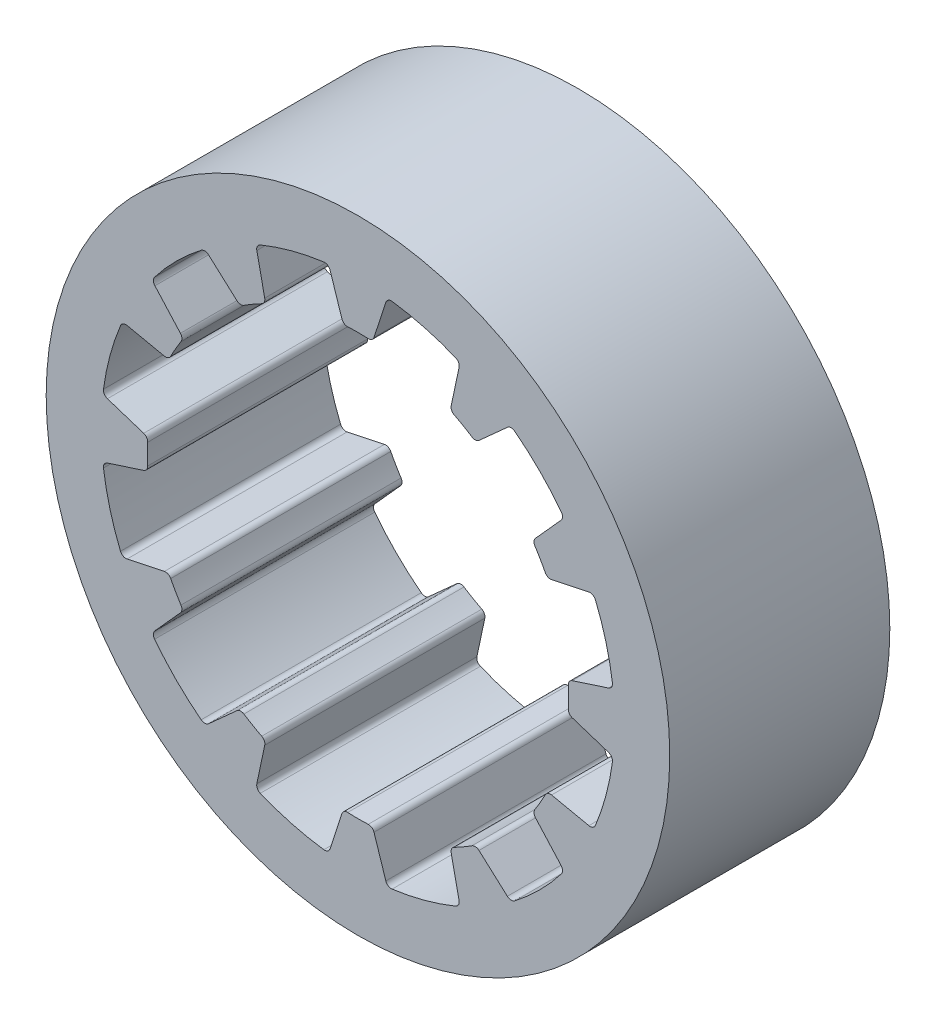
from build123d import *

# Parameters (mm, degrees)
MODEL_R             = 26.9875
BOSS_EXTRUDE1_DEPTH = 19.05


with BuildPart() as part:
    # Model → Boss-Extrude1 (new body)
    with BuildSketch(Plane.XY):
        Circle(MODEL_R)
        with BuildLine():
            ThreePointArc((-8.331075887, 16.209373818), (-8.108047548, 16.43944461), (-8.070485832, 16.757663602))
            Line((-8.070485832, 16.757663602), (-8.754511726, 19.987689799))
            ThreePointArc((-8.754511726, 19.987689799), (-8.707484905, 20.324784918), (-8.455586843, 20.553677922))
            ThreePointArc((-8.455586843, 20.553677922), (-5.752253282, 21.467701488), (-2.95408596, 22.027800642))
            ThreePointArc((-2.95408596, 22.027800642), (-2.621489336, 21.955522516), (-2.412215355, 21.687102989))
            Line((-2.412215355, 21.687102989), (-1.38958606, 18.5478053))
            ThreePointArc((-1.38958606, 18.5478053), (-1.197947162, 18.291000428), (-0.889763559, 18.203267447))
            ThreePointArc((-0.889763559, 18.203267447), (-4e-09, 18.224999999), (0.88976355, 18.203267448))
            ThreePointArc((0.88976355, 18.203267448), (1.197947153, 18.291000429), (1.38958605, 18.547805301))
            Line((1.38958605, 18.547805301), (2.412215346, 21.68710299))
            ThreePointArc((2.412215346, 21.68710299), (2.621489327, 21.955522516), (2.954085951, 22.027800641))
            ThreePointArc((2.954085951, 22.027800641), (5.752253273, 21.467701488), (8.455586835, 20.553677923))
            ThreePointArc((8.455586835, 20.553677923), (8.707484897, 20.324784919), (8.754511717, 19.9876898))
            Line((8.754511717, 19.9876898), (8.070485823, 16.757663603))
            ThreePointArc((8.070485823, 16.757663603), (8.108047539, 16.439444611), (8.331075878, 16.209373819))
            ThreePointArc((8.331075878, 16.209373819), (9.112499995, 15.783312983), (9.872191562, 15.319610264))
            ThreePointArc((9.872191562, 15.319610264), (10.182952881, 15.241497453), (10.47731947, 15.368077548))
            Line((10.47731947, 15.368077548), (12.932591265, 17.575474446))
            ThreePointArc((12.932591265, 17.575474446), (13.248037611, 17.703295585), (13.572213798, 17.599591967))
            ThreePointArc((13.572213798, 17.599591967), (15.715448207, 15.71544821), (17.599591964, 13.572213802))
            ThreePointArc((17.599591964, 13.572213802), (17.703295582, 13.248037614), (17.575474443, 12.932591268))
            Line((17.575474443, 12.932591268), (15.368077544, 10.477319473))
            ThreePointArc((15.368077544, 10.477319473), (15.24149745, 10.182952884), (15.319610261, 9.872191565))
            ThreePointArc((15.319610261, 9.872191565), (15.78331298, 9.112499998), (16.209373816, 8.331075881))
            ThreePointArc((16.209373816, 8.331075881), (16.439444608, 8.108047543), (16.7576636, 8.070485826))
            Line((16.7576636, 8.070485826), (19.987689797, 8.75451172))
            ThreePointArc((19.987689797, 8.75451172), (20.324784916, 8.707484899), (20.55367792, 8.455586837))
            ThreePointArc((20.55367792, 8.455586837), (21.467701485, 5.752253275), (22.027800638, 2.954085954))
            ThreePointArc((22.027800638, 2.954085954), (21.955522513, 2.62148933), (21.687102986, 2.412215349))
            Line((21.687102986, 2.412215349), (18.547805297, 1.389586053))
            ThreePointArc((18.547805297, 1.389586053), (18.291000425, 1.197947156), (18.203267445, 0.889763553))
            ThreePointArc((18.203267445, 0.889763553), (18.224999996, -2e-09), (18.203267445, -0.889763556))
            ThreePointArc((18.203267445, -0.889763556), (18.291000425, -1.19794716), (18.547805298, -1.389586057))
            Line((18.547805298, -1.389586057), (21.687102987, -2.412215353))
            ThreePointArc((21.687102987, -2.412215353), (21.955522514, -2.621489333), (22.027800639, -2.954085957))
            ThreePointArc((22.027800639, -2.954085957), (21.467701485, -5.752253279), (20.55367792, -8.455586841))
            ThreePointArc((20.55367792, -8.455586841), (20.324784915, -8.707484903), (19.987689796, -8.754511723))
            Line((19.987689796, -8.754511723), (16.757663599, -8.070485829))
            ThreePointArc((16.757663599, -8.070485829), (16.439444608, -8.108047546), (16.209373816, -8.331075885))
            ThreePointArc((16.209373816, -8.331075885), (15.78331298, -9.112500002), (15.319610261, -9.872191568))
            ThreePointArc((15.319610261, -9.872191568), (15.24149745, -10.182952888), (15.368077545, -10.477319476))
            Line((15.368077545, -10.477319476), (17.575474443, -12.932591272))
            ThreePointArc((17.575474443, -12.932591272), (17.703295583, -13.248037618), (17.599591965, -13.572213805))
            ThreePointArc((17.599591965, -13.572213805), (15.715448207, -15.715448213), (13.572213799, -17.59959197))
            ThreePointArc((13.572213799, -17.59959197), (13.248037611, -17.703295588), (12.932591265, -17.575474449))
            Line((12.932591265, -17.575474449), (10.47731947, -15.368077551))
            ThreePointArc((10.47731947, -15.368077551), (10.182952881, -15.241497457), (9.872191562, -15.319610268))
            ThreePointArc((9.872191562, -15.319610268), (9.112499996, -15.783312986), (8.331075878, -16.209373822))
            ThreePointArc((8.331075878, -16.209373822), (8.108047539, -16.439444614), (8.070485823, -16.757663607))
            Line((8.070485823, -16.757663607), (8.754511717, -19.987689803))
            ThreePointArc((8.754511717, -19.987689803), (8.707484897, -20.324784922), (8.455586834, -20.553677926))
            ThreePointArc((8.455586834, -20.553677926), (5.752253273, -21.467701491), (2.954085951, -22.027800644))
            ThreePointArc((2.954085951, -22.027800644), (2.621489325, -21.955522517), (2.412215346, -21.687102985))
            Line((2.412215346, -21.687102985), (1.38958605, -18.547805297))
            ThreePointArc((1.38958605, -18.547805297), (1.197947153, -18.291000425), (0.889763549, -18.203267444))
            ThreePointArc((0.889763549, -18.203267444), (-4e-09, -18.224999995), (-0.889763558, -18.203267444))
            ThreePointArc((-0.889763558, -18.203267444), (-1.197947162, -18.291000425), (-1.389586059, -18.547805297))
            Line((-1.389586059, -18.547805297), (-2.412215354, -21.687102986))
            ThreePointArc((-2.412215354, -21.687102986), (-2.621489335, -21.955522513), (-2.954085959, -22.027800639))
            ThreePointArc((-2.954085959, -22.027800639), (-5.75225328, -21.467701485), (-8.455586841, -20.55367792))
            ThreePointArc((-8.455586841, -20.55367792), (-8.707484903, -20.324784915), (-8.754511723, -19.987689797))
            Line((-8.754511723, -19.987689797), (-8.070485829, -16.7576636))
            ThreePointArc((-8.070485829, -16.7576636), (-8.108047546, -16.439444608), (-8.331075884, -16.209373816))
            ThreePointArc((-8.331075884, -16.209373816), (-9.112500001, -15.78331298), (-9.872191567, -15.319610262))
            ThreePointArc((-9.872191567, -15.319610262), (-10.182952886, -15.241497451), (-10.477319475, -15.368077546))
            Line((-10.477319475, -15.368077546), (-12.93259127, -17.575474444))
            ThreePointArc((-12.93259127, -17.575474444), (-13.248037616, -17.703295583), (-13.572213803, -17.599591965))
            ThreePointArc((-13.572213803, -17.599591965), (-15.715448211, -15.715448209), (-17.599591967, -13.572213801))
            ThreePointArc((-17.599591967, -13.572213801), (-17.703295585, -13.248037614), (-17.575474446, -12.932591267))
            Line((-17.575474446, -12.932591267), (-15.368077548, -10.477319472))
            ThreePointArc((-15.368077548, -10.477319472), (-15.241497453, -10.182952883), (-15.319610265, -9.872191564))
            ThreePointArc((-15.319610265, -9.872191564), (-15.783312983, -9.112499999), (-16.209373818, -8.331075882))
            ThreePointArc((-16.209373818, -8.331075882), (-16.439444611, -8.108047543), (-16.757663603, -8.070485827))
            Line((-16.757663603, -8.070485827), (-19.9876898, -8.754511721))
            ThreePointArc((-19.9876898, -8.754511721), (-20.324784919, -8.7074849), (-20.553677923, -8.455586838))
            ThreePointArc((-20.553677923, -8.455586838), (-21.467701487, -5.752253277), (-22.027800641, -2.954085957))
            ThreePointArc((-22.027800641, -2.954085957), (-21.955522516, -2.621489333), (-21.687102989, -2.412215352))
            Line((-21.687102989, -2.412215352), (-18.5478053, -1.389586056))
            ThreePointArc((-18.5478053, -1.389586056), (-18.291000428, -1.197947159), (-18.203267448, -0.889763556))
            ThreePointArc((-18.203267448, -0.889763556), (-18.224999999, -2e-09), (-18.203267448, 0.889763552))
            ThreePointArc((-18.203267448, 0.889763552), (-18.291000429, 1.197947155), (-18.547805301, 1.389586052))
            Line((-18.547805301, 1.389586052), (-21.68710299, 2.412215348))
            ThreePointArc((-21.68710299, 2.412215348), (-21.955522518, 2.621489329), (-22.027800643, 2.954085953))
            ThreePointArc((-22.027800643, 2.954085953), (-21.46770149, 5.752253274), (-20.553677925, 8.455586836))
            ThreePointArc((-20.553677925, 8.455586836), (-20.324784921, 8.707484898), (-19.987689802, 8.754511718))
            Line((-19.987689802, 8.754511718), (-16.757663605, 8.070485824))
            ThreePointArc((-16.757663605, 8.070485824), (-16.439444614, 8.108047541), (-16.209373822, 8.331075879))
            ThreePointArc((-16.209373822, 8.331075879), (-15.783312986, 9.112499997), (-15.319610268, 9.872191563))
            ThreePointArc((-15.319610268, 9.872191563), (-15.241497457, 10.182952882), (-15.368077552, 10.477319471))
            Line((-15.368077552, 10.477319471), (-17.57547445, 12.932591266))
            ThreePointArc((-17.57547445, 12.932591266), (-17.703295589, 13.248037612), (-17.599591971, 13.572213799))
            ThreePointArc((-17.599591971, 13.572213799), (-15.715448215, 15.715448208), (-13.572213807, 17.599591965))
            ThreePointArc((-13.572213807, 17.599591965), (-13.24803762, 17.703295583), (-12.932591273, 17.575474444))
            Line((-12.932591273, 17.575474444), (-10.477319478, 15.368077546))
            ThreePointArc((-10.477319478, 15.368077546), (-10.182952889, 15.241497452), (-9.87219157, 15.319610263))
            ThreePointArc((-9.87219157, 15.319610263), (-9.112500004, 15.783312982), (-8.331075887, 16.209373818))
        make_face(mode=Mode.SUBTRACT)
    extrude(amount=BOSS_EXTRUDE1_DEPTH)


solid = part.part
